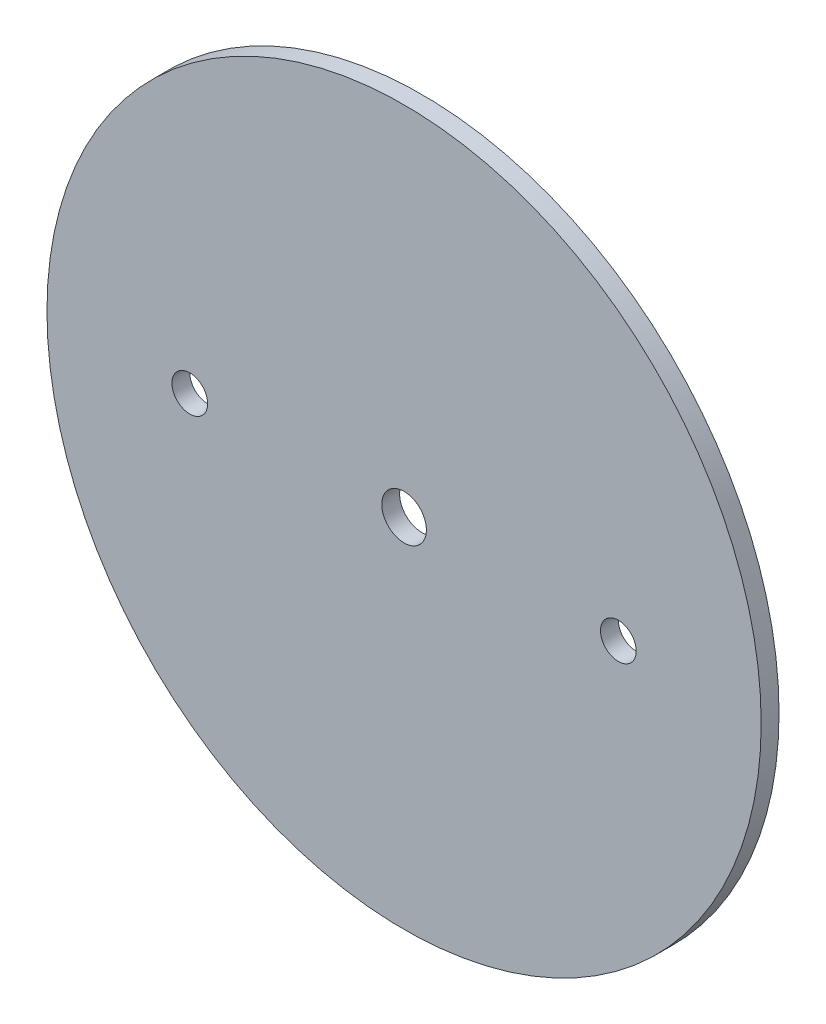
from build123d import *

# Parameters (mm, degrees)
SKETCH1_R                          = 63.5
BOSS_EXTRUDE1_DEPTH                = 1.5875
F_1_4_0_25_DIAMETER_HOLE1_D        = 6.35
F_5_16_0_3125_DIAMETER_HOLE1_D     = 7.9375
F_5_16_0_3125_DIAMETER_HOLE1_DEPTH = 3.302


with BuildPart() as part:
    # Sketch1 → Boss-Extrude1 (new, symmetric)
    with BuildSketch(Plane.XY):
        Circle(SKETCH1_R)
    extrude(amount=BOSS_EXTRUDE1_DEPTH, both=True)

    # 1/4 (0.25) Diameter Hole1 (through all)
    with Locations(Plane.XY.offset(1.5875)):
        with Locations((-38.1, 0), (38.1, 0)):
            Hole(F_1_4_0_25_DIAMETER_HOLE1_D / 2)

    # 5/16 (0.3125) Diameter Hole1
    with Locations(Plane.XY.offset(1.5875)):
        with Locations((0, 0)):
            Hole(F_5_16_0_3125_DIAMETER_HOLE1_D / 2, depth=F_5_16_0_3125_DIAMETER_HOLE1_DEPTH)


solid = part.part
